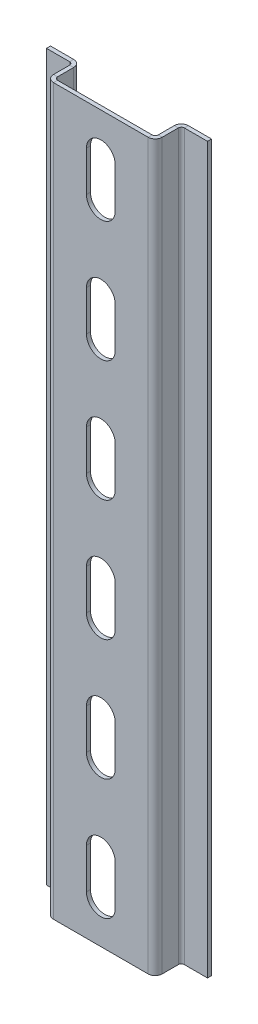
from build123d import *

# Parameters (mm, degrees)
SKETCH_2_W                         = 27
SKETCH_2_H                         = 180
SM_BASE_FLANGE_1_DEPTH             = 1
SM_EDGE_FLANGE_1_STRIP_W           = 5.4732
SM_EDGE_FLANGE_1_STRIP_H           = 1
SM_EDGE_FLANGE_1_STRIP_CUT_DEPTH   = 180
SM_EDGE_FLANGE_1_STRIP_2_W         = 5.4732
SM_EDGE_FLANGE_1_STRIP_2_H         = 1
SM_EDGE_FLANGE_1_STRIP_CUT_2_DEPTH = 180
SM_EDGE_FLANGE_1_DEPTH             = 180
SM_EDGE_FLANGE_1_BEND_DEPTH        = 180
SM_EDGE_FLANGE_2_STRIP_W           = 5.4732
SM_EDGE_FLANGE_2_STRIP_H           = 1
SM_EDGE_FLANGE_2_STRIP_CUT_DEPTH   = 180
SM_EDGE_FLANGE_2_STRIP_2_W         = 5.4732
SM_EDGE_FLANGE_2_STRIP_2_H         = 1
SM_EDGE_FLANGE_2_STRIP_CUT_2_DEPTH = 180
SM_EDGE_FLANGE_2_DEPTH             = 180
SM_EDGE_FLANGE_2_BEND_DEPTH        = 180
CUT_EXTRUDE_3_DEPTH                = 10
PATTERN_LINEAR_1_COUNT             = 9
PATTERN_LINEAR_1_PITCH             = 30


# Sheet-metal steps are written as plain solids
with BuildPart() as part:
    # 草图2 → 基体-法兰1 (new body)
    with BuildSketch(Plane.XY):
        with Locations((1.054557063, -109.215322961)):
            Rectangle(SKETCH_2_W, SKETCH_2_H)
    extrude(amount=-SM_BASE_FLANGE_1_DEPTH)

    # 边线-法兰1 strip (across the edge) → 边线-法兰1 strip cut (cut)
    with BuildSketch(Plane(origin=(-12.445442937, -199.215322961, -1), x_dir=(1, 0, 0), z_dir=(0, 1, 0))):
        with Locations((-1, -0.5)):
            Rectangle(SM_EDGE_FLANGE_1_STRIP_W, SM_EDGE_FLANGE_1_STRIP_H)
    extrude(amount=SM_EDGE_FLANGE_1_STRIP_CUT_DEPTH, mode=Mode.SUBTRACT)

    # 边线-法兰1 strip 2 (across the edge) → 边线-法兰1 strip cut 2 (cut)
    with BuildSketch(Plane(origin=(14.554557063, -19.215322961, -1), x_dir=(-1, 0, 0), z_dir=(0, -1, 0))):
        with Locations((-1, -0.5)):
            Rectangle(SM_EDGE_FLANGE_1_STRIP_2_W, SM_EDGE_FLANGE_1_STRIP_2_H)
    extrude(amount=SM_EDGE_FLANGE_1_STRIP_CUT_2_DEPTH, mode=Mode.SUBTRACT)

    # 边线-法兰1 section (across the edge) → 边线-法兰1 (add)
    with BuildSketch(Plane(origin=(-12.445442937, -199.215322961, -1), x_dir=(1, 0, 0), z_dir=(0, 1, 0))):
        with BuildLine():
            Line((0, 0.7366), (0, 6.5))
            Line((0, 6.5), (1, 6.5))
            Line((1, 6.5), (1, 0.7366))
            ThreePointArc((1, 0.7366), (1.215745145, 0.215745145), (1.7366, 0))
            Line((1.7366, 0), (1.7366, -1))
            ThreePointArc((1.7366, -1), (0.508638364, -0.491361636), (0, 0.7366))
        make_face()
    extrude(amount=SM_EDGE_FLANGE_1_DEPTH)

    # 边线-法兰1 section 2 (across the edge) → 边线-法兰1 bend (add)
    with BuildSketch(Plane(origin=(14.554557063, -19.215322961, -1), x_dir=(-1, 0, 0), z_dir=(0, -1, 0))):
        with BuildLine():
            Line((0, 0.7366), (0, 6.5))
            Line((0, 6.5), (1, 6.5))
            Line((1, 6.5), (1, 0.7366))
            ThreePointArc((1, 0.7366), (1.215745145, 0.215745145), (1.7366, 0))
            Line((1.7366, 0), (1.7366, -1))
            ThreePointArc((1.7366, -1), (0.508638364, -0.491361636), (0, 0.7366))
        make_face()
    extrude(amount=SM_EDGE_FLANGE_1_BEND_DEPTH)

    # 边线-法兰2 strip (across the edge) → 边线-法兰2 strip cut (cut)
    with BuildSketch(Plane(origin=(-12.445442937, -19.215322961, -7.5), x_dir=(0, 0, 1), z_dir=(0, -1, 0))):
        with Locations((-1, -0.5)):
            Rectangle(SM_EDGE_FLANGE_2_STRIP_W, SM_EDGE_FLANGE_2_STRIP_H)
    extrude(amount=SM_EDGE_FLANGE_2_STRIP_CUT_DEPTH, mode=Mode.SUBTRACT)

    # 边线-法兰2 strip 2 (across the edge) → 边线-法兰2 strip cut 2 (cut)
    with BuildSketch(Plane(origin=(14.554557063, -199.215322961, -7.5), x_dir=(0, 0, 1), z_dir=(0, 1, 0))):
        with Locations((-1, -0.5)):
            Rectangle(SM_EDGE_FLANGE_2_STRIP_2_W, SM_EDGE_FLANGE_2_STRIP_2_H)
    extrude(amount=SM_EDGE_FLANGE_2_STRIP_CUT_2_DEPTH, mode=Mode.SUBTRACT)

    # 边线-法兰2 section (across the edge) → 边线-法兰2 (add)
    with BuildSketch(Plane(origin=(-12.445442937, -19.215322961, -7.5), x_dir=(0, 0, 1), z_dir=(0, -1, 0))):
        with BuildLine():
            Line((0, 0.7366), (0, 6.5))
            Line((0, 6.5), (1, 6.5))
            Line((1, 6.5), (1, 0.7366))
            ThreePointArc((1, 0.7366), (1.215745145, 0.215745145), (1.7366, 0))
            Line((1.7366, 0), (1.7366, -1))
            ThreePointArc((1.7366, -1), (0.508638364, -0.491361636), (0, 0.7366))
        make_face()
    extrude(amount=SM_EDGE_FLANGE_2_DEPTH)

    # 边线-法兰2 section 2 (across the edge) → 边线-法兰2 bend (add)
    with BuildSketch(Plane(origin=(14.554557063, -199.215322961, -7.5), x_dir=(0, 0, 1), z_dir=(0, 1, 0))):
        with BuildLine():
            Line((0, 0.7366), (0, 6.5))
            Line((0, 6.5), (1, 6.5))
            Line((1, 6.5), (1, 0.7366))
            ThreePointArc((1, 0.7366), (1.215745145, 0.215745145), (1.7366, 0))
            Line((1.7366, 0), (1.7366, -1))
            ThreePointArc((1.7366, -1), (0.508638364, -0.491361636), (0, 0.7366))
        make_face()
    extrude(amount=SM_EDGE_FLANGE_2_BEND_DEPTH)

    # 草图17 → 切除-拉伸3 (cut)
    with BuildSketch(Plane.XY):
        with BuildLine():
            Line((4.626807443, -189.215322961), (4.626807443, -179.215322961))
            ThreePointArc((4.626807443, -179.215322961), (1.054557063, -175.643072581), (-2.517693316, -179.215322961))
            Line((-2.517693316, -179.215322961), (-2.517693316, -189.215322961))
            ThreePointArc((-2.517693316, -189.215322961), (1.054557063, -192.78757334), (4.626807443, -189.215322961))
        make_face()
    cut_extrude_3 = extrude(amount=-CUT_EXTRUDE_3_DEPTH, mode=Mode.SUBTRACT)

    # 阵列(线性)1: 切除-拉伸3 ×9
    with Locations(*[(0, i * PATTERN_LINEAR_1_PITCH, 0) for i in range(1, PATTERN_LINEAR_1_COUNT)]):
        add(cut_extrude_3, mode=Mode.SUBTRACT)


solid = part.part
